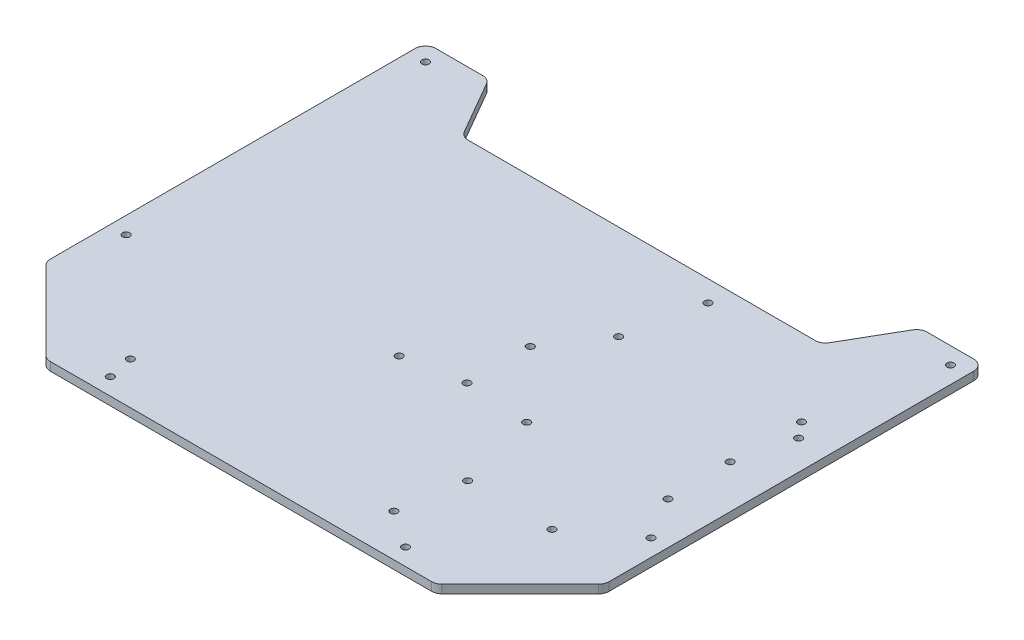
from build123d import *

# Parameters (mm, degrees)
MAIN_EXTRUSION_DEPTH    = 4
CONG_1_R                = 5
ESQUISSE1_R             = 1
ENL_V_MAT_EXTRU_1_DEPTH = 257.850637531
D_GAGEMENT_M31_D        = 3.4
ESQUISSE4_R             = 1
ENL_V_MAT_EXTRU_2_DEPTH = 257.850637531
D_GAGEMENT_M32_D        = 3.4


with BuildPart() as part:
    # Main scetch → Main extrusion (new body)
    with BuildSketch(Plane(origin=(0, 0, 0), x_dir=(1, 0, 0), z_dir=(0, 1, 0))):
        Polygon((-92.5, 0), (92.5, 0), (132.5, 40), (132.5, 220), (102.5, 220), (85.179491924, 190), (-85.179491924, 190), (-102.5, 220), (-132.5, 220), (-132.5, 40), align=None)
    extrude(amount=MAIN_EXTRUSION_DEPTH)

    # Congé1
    cong_1_edges = [part.edges().sort_by_distance(p)[0] for p in [
        (-132.5, 2, -40),
        (-92.5, 2, 0),
        (92.5, 2, 0),
        (132.5, 2, -40),
        (132.5, 2, -220),
        (102.5, 2, -220),
        (85.179491924, 2, -190),
        (-85.179491924, 2, -190),
        (-102.5, 2, -220),
        (-132.5, 2, -220),
    ]]
    fillet(cong_1_edges, radius=CONG_1_R)

    # Esquisse1 → Enlèv. mat.-Extru.1 (cut, through all)
    with BuildSketch(Plane(origin=(0, 4, 0), x_dir=(1, 0, 0), z_dir=(0, 1, 0))):
        with Locations((70, 8)):
            Circle(ESQUISSE1_R)
        with Locations((124.5, 70)):
            Circle(ESQUISSE1_R)
        with Locations((124.5, 212)):
            Circle(ESQUISSE1_R)
        with Locations((-124.5, 212)):
            Circle(ESQUISSE1_R)
        with Locations((-124.5, 70)):
            Circle(ESQUISSE1_R)
        with Locations((-70, 8)):
            Circle(ESQUISSE1_R)
    extrude(amount=-ENL_V_MAT_EXTRU_1_DEPTH, mode=Mode.SUBTRACT)

    # Dégagement M31 (through all)
    with Locations(Plane(origin=(0, 4, 0), x_dir=(1, 0, 0), z_dir=(0, 1, 0))):
        with Locations((-124.5, 212), (-124.5, 70), (-70, 8), (70, 8), (124.5, 70), (124.5, 212)):
            Hole(D_GAGEMENT_M31_D / 2)

    # Esquisse4 → Enlèv. mat.-Extru.2 (cut, through all)
    with BuildSketch(Plane(origin=(0, 4, 0), x_dir=(1, 0, 0), z_dir=(0, 1, 0))):
        with Locations((41.5, 180)):
            Circle(ESQUISSE4_R)
        with Locations((34.12, 145)):
            Circle(ESQUISSE4_R)
        with Locations((112.5, 153.32)):
            Circle(ESQUISSE4_R)
        with Locations((118.5, 146)):
            Circle(ESQUISSE4_R)
        with Locations((112, 120)):
            Circle(ESQUISSE4_R)
        with Locations((112.5, 90)):
            Circle(ESQUISSE4_R)
        with Locations((17.2, 120)):
            Circle(ESQUISSE4_R)
        with Locations((17.2, 90)):
            Circle(ESQUISSE4_R)
        with Locations((47.5, 88)):
            Circle(ESQUISSE4_R)
        with Locations((57.5, 50)):
            Circle(ESQUISSE4_R)
        with Locations((97.5, 50)):
            Circle(ESQUISSE4_R)
        with Locations((52.5, 20)):
            Circle(ESQUISSE4_R)
        with Locations((-10, 85)):
            Circle(ESQUISSE4_R)
        with Locations((-72.5, 20)):
            Circle(ESQUISSE4_R)
    extrude(amount=-ENL_V_MAT_EXTRU_2_DEPTH, mode=Mode.SUBTRACT)

    # Dégagement M32 (through all)
    with Locations(Plane(origin=(0, 4, 0), x_dir=(1, 0, 0), z_dir=(0, 1, 0))):
        with Locations((17.2, 120), (34.12, 145), (41.5, 180), (112.5, 153.32), (118.5, 146), (112, 120), (112.5, 90), (47.5, 88), (17.2, 90), (57.5, 50), (97.5, 50), (-10, 85), (-72.5, 20), (52.5, 20)):
            Hole(D_GAGEMENT_M32_D / 2)


solid = part.part
